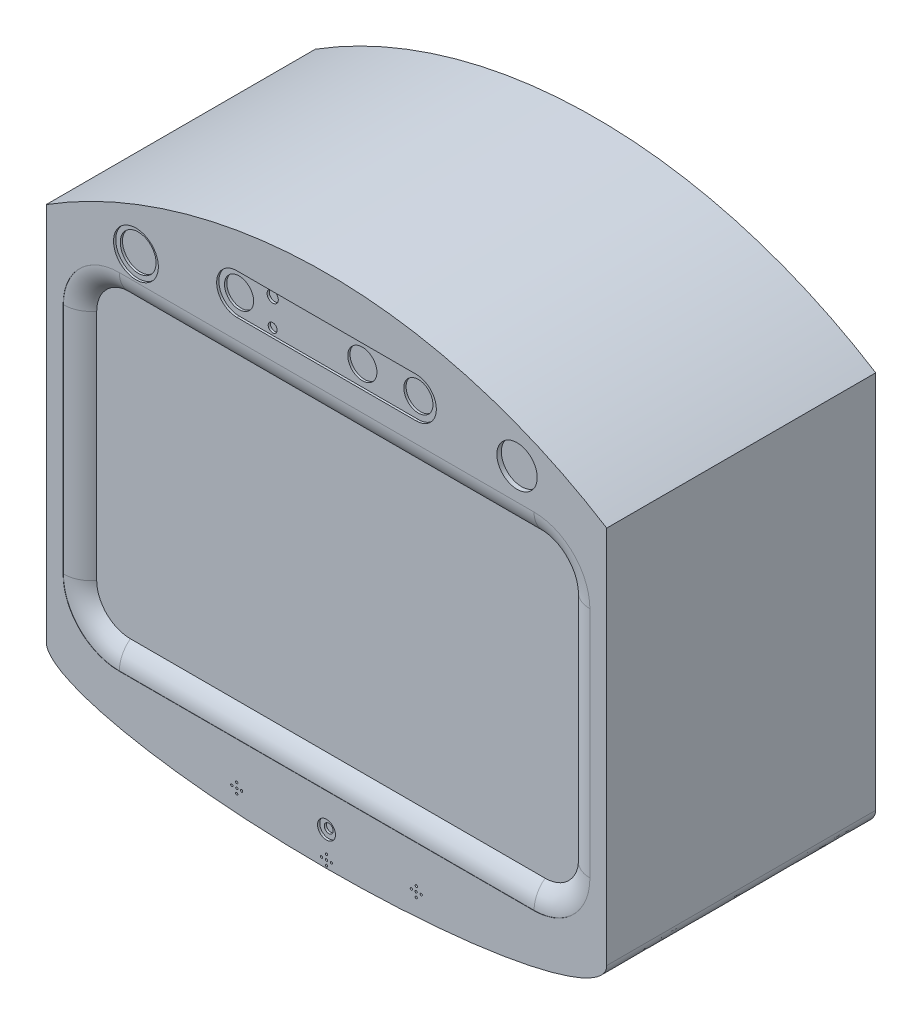
from build123d import *

# Parameters (mm, degrees)
ESBO_O1_W                = 250
ESBO_O1_H                = 194
RESSALTO_EXTRUS_O1_DEPTH = 120
ESBO_O2_W                = 215
ESBO_O2_H                = 134
CORTE_EXTRUS_O1_DEPTH    = 5
FILETE1_R                = 15
RESSALTO_EXTRUS_O2_DEPTH = 120
CORTE_EXTRUS_O2_DEPTH    = 0.1
FILETE2_SIZE             = 125
FILETE2_SIZE_2           = 25
ESBO_O7_R                = 4
CORTE_EXTRUS_O3_DEPTH    = 1
ESBO_O8_R                = 2
CORTE_EXTRUS_O4_DEPTH    = 1
ESBO_O9_R                = 0.5
CORTE_EXTRUS_O5_DEPTH    = 1
FILETE4_R                = 12.5
ESBO_O10_R               = 10
CORTE_EXTRUS_O6_DEPTH    = 1
ESBO_O11_R               = 6.5
ESBO_O11_R_2             = 2.5
ESBO_O11_R_3             = 2
ESBO_O11_R_4             = 8
CORTE_EXTRUS_O7_DEPTH    = 1
ESBO_O14_R               = 9
CORTE_EXTRUS_O9_DEPTH    = 2


with BuildPart() as part:
    # Esboço1 → Ressalto-extrusão1 (new body)
    with BuildSketch(Plane.XY):
        Rectangle(ESBO_O1_W, ESBO_O1_H)
    extrude(amount=-RESSALTO_EXTRUS_O1_DEPTH)

    # Esboço2 → Corte-extrusão1 (cut)
    with BuildSketch(Plane.XY):
        with Locations((0, 10)):
            Rectangle(ESBO_O2_W, ESBO_O2_H)
    extrude(amount=-CORTE_EXTRUS_O1_DEPTH, mode=Mode.SUBTRACT)

    # Filete1
    filete1_edges = [part.edges().sort_by_distance(p)[0] for p in [
        (-107.5, 77, -2.5),
        (107.5, 77, -2.5),
        (107.5, -57, -2.5),
        (-107.5, -57, -2.5),
    ]]
    fillet(filete1_edges, radius=FILETE1_R)

    # Esboço3 → Ressalto-extrusão2 (add)
    with BuildSketch(Plane.XY):
        with BuildLine():
            Line((-125, 97), (125, 97))
            ThreePointArc((125, 97), (0, 133), (-125, 97))
        make_face()
    extrude(amount=-RESSALTO_EXTRUS_O2_DEPTH)

    # Esboço4 → Corte-extrusão2 (cut)
    with BuildSketch(Plane.XY):
        with BuildLine():
            Line((117.5, -42), (117.5, 62))
            ThreePointArc((117.5, 62), (110.17766953, 79.67766953), (92.5, 87))
            Line((92.5, 87), (-92.5, 87))
            ThreePointArc((-92.5, 87), (-110.17766953, 79.67766953), (-117.5, 62))
            Line((-117.5, 62), (-117.5, -42))
            ThreePointArc((-117.5, -42), (-110.17766953, -59.67766953), (-92.5, -67))
            Line((-92.5, -67), (92.5, -67))
            ThreePointArc((92.5, -67), (110.17766953, -59.67766953), (117.5, -42))
        make_face()
    extrude(amount=-CORTE_EXTRUS_O2_DEPTH, mode=Mode.SUBTRACT)

    # Filete2
    # a fillet whose section is not a circle: 125, 25 mm, written as the material it takes off along each edge
    with BuildSketch(Plane(origin=(125, -97, 312.5), x_dir=(-1, 0, 0), z_dir=(0, 0, -1))) as filete2_piece_1:
        with BuildLine():
            Bezier((FILETE2_SIZE, 0), (0, 0), (0, FILETE2_SIZE_2), weights=[1, 0.707106781, 1])
            Line((0, FILETE2_SIZE_2), (0, 0))
            Line((0, 0), (FILETE2_SIZE, 0))
        make_face()
    extrude(amount=745, mode=Mode.SUBTRACT)
    with BuildSketch(Plane(origin=(-125, -97, 312.5), x_dir=(1, 0, 0), z_dir=(0, 0, -1))) as filete2_piece_2:
        with BuildLine():
            Bezier((FILETE2_SIZE, 0), (0, 0), (0, -FILETE2_SIZE_2), weights=[1, 0.707106781, 1])
            Line((0, -FILETE2_SIZE_2), (0, 0))
            Line((0, 0), (FILETE2_SIZE, 0))
        make_face()
    extrude(amount=745, mode=Mode.SUBTRACT)

    # Esboço7 → Corte-extrusão3 (cut)
    with BuildSketch(Plane.XY):
        with Locations((0, -82)):
            Circle(ESBO_O7_R)
    extrude(amount=-CORTE_EXTRUS_O3_DEPTH, mode=Mode.SUBTRACT)

    # Esboço8 → Corte-extrusão4 (cut)
    with BuildSketch(Plane.XY.offset(-1)):
        with Locations((0, -82)):
            Circle(ESBO_O8_R)
    extrude(amount=-CORTE_EXTRUS_O4_DEPTH, mode=Mode.SUBTRACT)

    # Esboço9 → Corte-extrusão5 (cut)
    with BuildSketch(Plane.XY):
        with Locations((0, -91.5)):
            Circle(ESBO_O9_R)
        with Locations((0, -93.7)):
            Circle(ESBO_O9_R)
        with Locations((0, -95.9)):
            Circle(ESBO_O9_R)
        with Locations((2.2, -93.7)):
            Circle(ESBO_O9_R)
        with Locations((-2.2, -93.7)):
            Circle(ESBO_O9_R)
        with Locations((40.052268552, -83.754189239)):
            Circle(ESBO_O9_R)
        with Locations((40.052268552, -88.154189239)):
            Circle(ESBO_O9_R)
        with Locations((42.252268552, -85.954189239)):
            Circle(ESBO_O9_R)
        with Locations((37.852268552, -85.954189239)):
            Circle(ESBO_O9_R)
        with Locations((40, -86)):
            Circle(ESBO_O9_R)
        with Locations(Location((-42.252268552, -85.954189239, 0), (0, 0, 180))):
            Circle(ESBO_O9_R)
        with Locations(Location((-40.052268552, -83.754189239, 0), (0, 0, 180))):
            Circle(ESBO_O9_R)
        with Locations(Location((-40, -86, 0), (0, 0, 180))):
            Circle(ESBO_O9_R)
        with Locations(Location((-37.852268552, -85.954189239, 0), (0, 0, 180))):
            Circle(ESBO_O9_R)
        with Locations(Location((-40.052268552, -88.154189239, 0), (0, 0, 180))):
            Circle(ESBO_O9_R)
    extrude(amount=-CORTE_EXTRUS_O5_DEPTH, mode=Mode.SUBTRACT)

    # Filete4
    # the kernel refuses this fillet: 12.5 mm, written as the material it takes off along each edge
    with BuildSketch(Plane(origin=(92.5, 62, -0.1), x_dir=(0, 1, 0), z_dir=(-1, 0, 0))) as filete4_piece_1:
        with BuildLine():
            CenterArc((24.924212815, 12.5), FILETE4_R, 217.445030013, 52.554969987)
            Line((15, 4.9), (15, 0))
            Line((15, 0), (24.924212815, 0))
        make_face()
    revolve(axis=Axis((92.5, 62, -0.1), (0, 0, -1)), revolution_arc=90, mode=Mode.SUBTRACT)
    with BuildSketch(Plane(origin=(-92.5, 77, -0.1), x_dir=(0, 1, 0), z_dir=(1, 0, 0)), Plane(origin=(92.5, -57, -0.1), x_dir=(0, -1, 0), z_dir=(-1, 0, 0))) as filete4_piece_2:
        with BuildLine():
            CenterArc((9.924212815, -12.5), FILETE4_R, 90, 52.554969987)
            Line((0, -4.9), (0, 0))
            Line((0, 0), (9.924212815, 0))
        make_face()
    extrude(amount=185, mode=Mode.SUBTRACT)
    with BuildSketch(Plane(origin=(-92.5, 62, -0.1), x_dir=(-1, 0, 0), z_dir=(0, -1, 0))) as filete4_piece_3:
        with BuildLine():
            CenterArc((24.924212815, 12.5), FILETE4_R, 217.445030013, 52.554969987)
            Line((15, 4.9), (15, 0))
            Line((15, 0), (24.924212815, 0))
        make_face()
    revolve(axis=Axis((-92.5, 62, -0.1), (0, 0, -1)), revolution_arc=90, mode=Mode.SUBTRACT)
    with BuildSketch(Plane(origin=(-107.5, -42, -0.1), x_dir=(-1, 0, 0), z_dir=(0, 1, 0)), Plane(origin=(107.5, 62, -0.1), x_dir=(1, 0, 0), z_dir=(0, -1, 0))) as filete4_piece_4:
        with BuildLine():
            CenterArc((9.924212815, -12.5), FILETE4_R, 90, 52.554969987)
            Line((0, -4.9), (0, 0))
            Line((0, 0), (9.924212815, 0))
        make_face()
    extrude(amount=104, mode=Mode.SUBTRACT)
    with BuildSketch(Plane(origin=(-92.5, -42, -0.1), x_dir=(0, -1, 0), z_dir=(1, 0, 0))) as filete4_piece_5:
        with BuildLine():
            CenterArc((24.924212815, 12.5), FILETE4_R, 217.445030013, 52.554969987)
            Line((15, 4.9), (15, 0))
            Line((15, 0), (24.924212815, 0))
        make_face()
    revolve(axis=Axis((-92.5, -42, -0.1), (0, 0, -1)), revolution_arc=90, mode=Mode.SUBTRACT)
    with BuildSketch(Plane(origin=(92.5, -42, -0.1), x_dir=(1, 0, 0), z_dir=(0, 1, 0))) as filete4_piece_6:
        with BuildLine():
            CenterArc((24.924212815, 12.5), FILETE4_R, 217.445030013, 52.554969987)
            Line((15, 4.9), (15, 0))
            Line((15, 0), (24.924212815, 0))
        make_face()
    revolve(axis=Axis((92.5, -42, -0.1), (0, 0, -1)), revolution_arc=90, mode=Mode.SUBTRACT)

    # Esboço10 → Corte-extrusão6 (cut)
    with BuildSketch(Plane.XY):
        with Locations((-85, 97.924212815)):
            Circle(ESBO_O10_R)
        with BuildLine():
            Line((-40, 113.924212815), (40, 113.924212815))
            ThreePointArc((40, 113.924212815), (49, 104.924212815), (40, 95.924212815))
            Line((40, 95.924212815), (-40, 95.924212815))
            ThreePointArc((-40, 95.924212815), (-49, 104.924212815), (-40, 113.924212815))
        make_face()
    extrude(amount=-CORTE_EXTRUS_O6_DEPTH, mode=Mode.SUBTRACT)

    # Esboço11 → Corte-extrusão7 (cut)
    with BuildSketch(Plane.XY.offset(-1)):
        with Locations((-40, 104.924212815)):
            Circle(ESBO_O11_R)
        with Locations((40, 104.924212815)):
            Circle(ESBO_O11_R)
        with Locations((15, 104.924212815)):
            Circle(ESBO_O11_R)
        with Locations((-25, 110.924212815)):
            Circle(ESBO_O11_R_2)
        with Locations((-25, 98.924212815)):
            Circle(ESBO_O11_R_3)
        with Locations((-85, 97.924212815)):
            Circle(ESBO_O11_R_4)
    extrude(amount=-CORTE_EXTRUS_O7_DEPTH, mode=Mode.SUBTRACT)

    # Esboço14 → Corte-extrusão9 (cut)
    with BuildSketch(Plane.XY):
        with Locations((85, 101)):
            Circle(ESBO_O14_R)
    extrude(amount=-CORTE_EXTRUS_O9_DEPTH, mode=Mode.SUBTRACT)


solid = part.part
